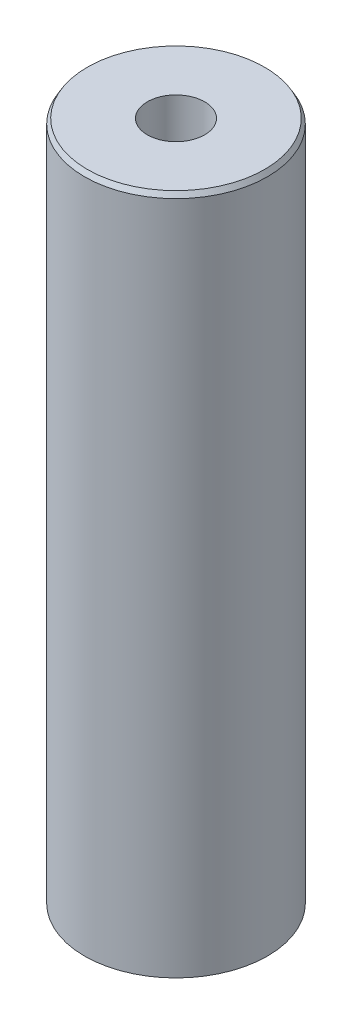
from build123d import *
from OCP.BRepFilletAPI import BRepFilletAPI_MakeChamfer

# Parameters (mm, degrees)
SKETCH1_R           = 15
BOSS_EXTRUDE1_DEPTH = 111.945952678
SKETCH2_R           = 4.703215007
CUT_EXTRUDE1_DEPTH  = 114.938124967
CHAMFER1_SIZE       = 0.806305885
CHAMFER1_SIZE2      = 0.465520919


with BuildPart() as part:
    # Sketch1 → Boss-Extrude1 (new body)
    with BuildSketch(Plane(origin=(0, 0, 0), x_dir=(1, 0, 0), z_dir=(0, 1, 0))):
        Circle(SKETCH1_R)
    extrude(amount=BOSS_EXTRUDE1_DEPTH)

    # Sketch2 → Cut-Extrude1 (cut, through all)
    with BuildSketch(Plane(origin=(0, 0, 0), x_dir=(1, 0, 0), z_dir=(0, 1, 0))):
        Circle(SKETCH2_R)
    extrude(amount=CUT_EXTRUDE1_DEPTH, mode=Mode.SUBTRACT)

    # Chamfer1: one chamfer whose edges measure the first distance from different faces: ONE call of the kernel's chamfer builder (chamfer() names one face for all edges)
    chamfer1_edges_1 = [part.edges().sort_by_distance(p)[0] for p in [
        (-15, 111.945952678, 0),
    ]]
    chamfer1_side_1 = [part.faces().sort_by_distance(p)[0] for p in [
        (-15, 55.972976339, 0),
    ]]
    chamfer1_edges_2 = [part.edges().sort_by_distance(p)[0] for p in [
        (-15, 0, 0),
    ]]
    chamfer1_side_2 = [part.faces().sort_by_distance(p)[0] for p in [
        (-14.575735931, 0, 0),
    ]]
    chamfer1 = BRepFilletAPI_MakeChamfer(part.part.solid().wrapped)
    for e in chamfer1_edges_1:
        chamfer1.Add(CHAMFER1_SIZE, CHAMFER1_SIZE2, e.wrapped, chamfer1_side_1[0].wrapped)  # the first distance lies on this face
    for e in chamfer1_edges_2:
        chamfer1.Add(CHAMFER1_SIZE, CHAMFER1_SIZE2, e.wrapped, chamfer1_side_2[0].wrapped)  # the first distance lies on this face
    add(Compound.cast(chamfer1.Shape()), mode=Mode.REPLACE)


solid = part.part
